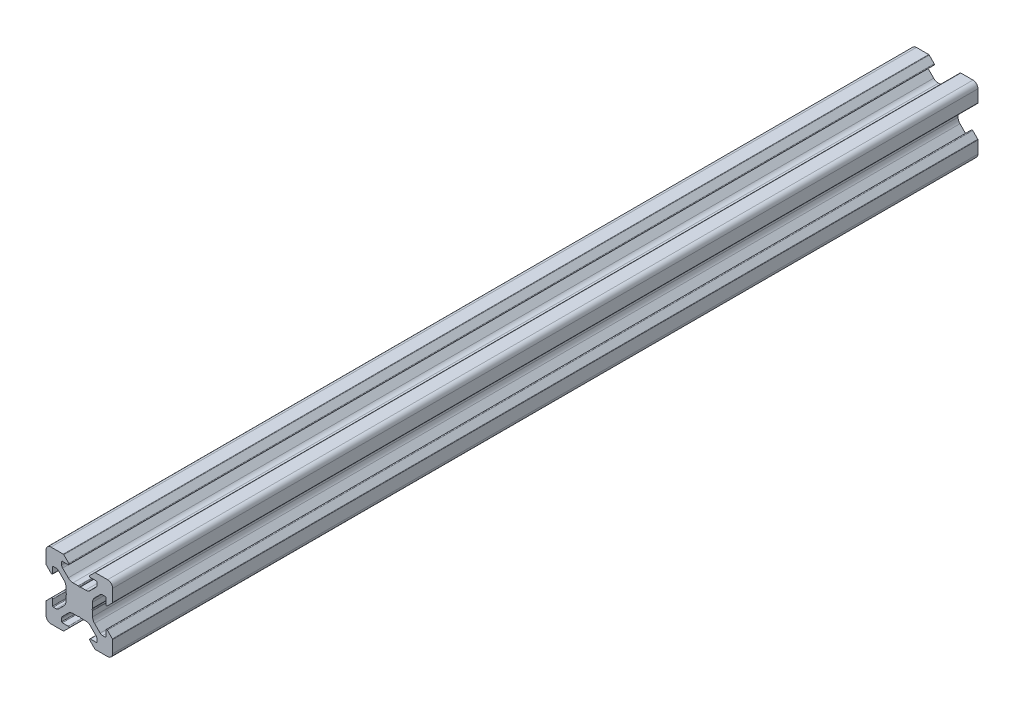
from build123d import *

# Parameters (mm, degrees)
EXTRUDE_1_DEPTH = 260


# Read off the part's stored shape, not the designer's step: 222 Конструкционный профиль 20х20-1-surface1
with BuildPart() as part:
    # Эскиз1 → Бобышка-Вытянуть1 (new body)
    with BuildSketch(Plane.XY):
        with BuildLine():
            Line((-3.945217202, 0.181521503), (-3.8, 0))
            Line((-3.8, 0), (-3.945217202, -0.181521503))
            ThreePointArc((-3.945217202, -0.181521503), (-3.98590708, -0.254943529), (-4, -0.337695265))
            Line((-4, -0.337695265), (-4, -1.898780669))
            ThreePointArc((-4, -1.898780669), (-4.152240935, -2.664147534), (-4.585786438, -3.312994231))
            Line((-4.585786438, -3.312994231), (-6.279898987, -5.007106781))
            ThreePointArc((-6.279898987, -5.007106781), (-6.604322336, -5.223879533), (-6.987005769, -5.3))
            Line((-6.987005769, -5.3), (-7.8, -5.3))
            ThreePointArc((-7.8, -5.3), (-7.941421356, -5.241421356), (-8, -5.1))
            Line((-8, -5.1), (-8, -3.33))
            ThreePointArc((-8, -3.33), (-8.154329142, -3.099030117), (-8.426776695, -3.153223305))
            Line((-8.426776695, -3.153223305), (-9.926776695, -4.653223305))
            ThreePointArc((-9.926776695, -4.653223305), (-9.980969883, -4.734329142), (-10, -4.83))
            Line((-10, -4.83), (-10, -8.5))
            ThreePointArc((-10, -8.5), (-9.560660172, -9.560660172), (-8.5, -10))
            Line((-8.5, -10), (-4.83, -10))
            ThreePointArc((-4.83, -10), (-4.734329142, -9.980969883), (-4.653223305, -9.926776695))
            Line((-4.653223305, -9.926776695), (-3.153223305, -8.426776695))
            ThreePointArc((-3.153223305, -8.426776695), (-3.099030117, -8.154329142), (-3.33, -8))
            Line((-3.33, -8), (-5.1, -8))
            ThreePointArc((-5.1, -8), (-5.241421356, -7.941421356), (-5.3, -7.8))
            Line((-5.3, -7.8), (-5.3, -6.987005769))
            ThreePointArc((-5.3, -6.987005769), (-5.223879533, -6.604322336), (-5.007106781, -6.279898987))
            Line((-5.007106781, -6.279898987), (-3.312994231, -4.585786438))
            ThreePointArc((-3.312994231, -4.585786438), (-2.664147534, -4.152240935), (-1.898780669, -4))
            Line((-1.898780669, -4), (-0.337695265, -4))
            ThreePointArc((-0.337695265, -4), (-0.254943529, -3.98590708), (-0.181521503, -3.945217202))
            Line((-0.181521503, -3.945217202), (0, -3.8))
            Line((0, -3.8), (0.181521503, -3.945217202))
            ThreePointArc((0.181521503, -3.945217202), (0.254943529, -3.98590708), (0.337695265, -4))
            Line((0.337695265, -4), (1.898780669, -4))
            ThreePointArc((1.898780669, -4), (2.664147534, -4.152240935), (3.312994231, -4.585786438))
            Line((3.312994231, -4.585786438), (5.007106781, -6.279898987))
            ThreePointArc((5.007106781, -6.279898987), (5.223879533, -6.604322336), (5.3, -6.987005769))
            Line((5.3, -6.987005769), (5.3, -7.8))
            ThreePointArc((5.3, -7.8), (5.241421356, -7.941421356), (5.1, -8))
            Line((5.1, -8), (3.33, -8))
            ThreePointArc((3.33, -8), (3.099030117, -8.154329142), (3.153223305, -8.426776695))
            Line((3.153223305, -8.426776695), (4.653223305, -9.926776695))
            ThreePointArc((4.653223305, -9.926776695), (4.734329142, -9.980969883), (4.83, -10))
            Line((4.83, -10), (8.5, -10))
            ThreePointArc((8.5, -10), (9.560660172, -9.560660172), (10, -8.5))
            Line((10, -8.5), (10, -4.83))
            ThreePointArc((10, -4.83), (9.980969883, -4.734329142), (9.926776695, -4.653223305))
            Line((9.926776695, -4.653223305), (8.426776695, -3.153223305))
            ThreePointArc((8.426776695, -3.153223305), (8.154329142, -3.099030117), (8, -3.33))
            Line((8, -3.33), (8, -5.1))
            ThreePointArc((8, -5.1), (7.941421356, -5.241421356), (7.8, -5.3))
            Line((7.8, -5.3), (6.987005769, -5.3))
            ThreePointArc((6.987005769, -5.3), (6.604322336, -5.223879533), (6.279898987, -5.007106781))
            Line((6.279898987, -5.007106781), (4.585786438, -3.312994231))
            ThreePointArc((4.585786438, -3.312994231), (4.152240935, -2.664147534), (4, -1.898780669))
            Line((4, -1.898780669), (4, -0.337695265))
            ThreePointArc((4, -0.337695265), (3.98590708, -0.254943529), (3.945217202, -0.181521503))
            Line((3.945217202, -0.181521503), (3.8, 0))
            Line((3.8, 0), (3.945217202, 0.181521503))
            ThreePointArc((3.945217202, 0.181521503), (3.98590708, 0.254943529), (4, 0.337695265))
            Line((4, 0.337695265), (4, 1.898780669))
            ThreePointArc((4, 1.898780669), (4.152240935, 2.664147534), (4.585786438, 3.312994231))
            Line((4.585786438, 3.312994231), (6.279898987, 5.007106781))
            ThreePointArc((6.279898987, 5.007106781), (6.604322336, 5.223879533), (6.987005769, 5.3))
            Line((6.987005769, 5.3), (7.8, 5.3))
            ThreePointArc((7.8, 5.3), (7.941421356, 5.241421356), (8, 5.1))
            Line((8, 5.1), (8, 3.33))
            ThreePointArc((8, 3.33), (8.154329142, 3.099030117), (8.426776695, 3.153223305))
            Line((8.426776695, 3.153223305), (9.926776695, 4.653223305))
            ThreePointArc((9.926776695, 4.653223305), (9.980969883, 4.734329142), (10, 4.83))
            Line((10, 4.83), (10, 8.5))
            ThreePointArc((10, 8.5), (9.560660172, 9.560660172), (8.5, 10))
            Line((8.5, 10), (4.83, 10))
            ThreePointArc((4.83, 10), (4.734329142, 9.980969883), (4.653223305, 9.926776695))
            Line((4.653223305, 9.926776695), (3.153223305, 8.426776695))
            ThreePointArc((3.153223305, 8.426776695), (3.099030117, 8.154329142), (3.33, 8))
            Line((3.33, 8), (5.1, 8))
            ThreePointArc((5.1, 8), (5.241421356, 7.941421356), (5.3, 7.8))
            Line((5.3, 7.8), (5.3, 6.987005769))
            ThreePointArc((5.3, 6.987005769), (5.223879533, 6.604322336), (5.007106781, 6.279898987))
            Line((5.007106781, 6.279898987), (3.312994231, 4.585786438))
            ThreePointArc((3.312994231, 4.585786438), (2.664147534, 4.152240935), (1.898780669, 4))
            Line((1.898780669, 4), (0.337695265, 4))
            ThreePointArc((0.337695265, 4), (0.254943529, 3.98590708), (0.181521503, 3.945217202))
            Line((0.181521503, 3.945217202), (0, 3.8))
            Line((0, 3.8), (-0.181521503, 3.945217202))
            ThreePointArc((-0.181521503, 3.945217202), (-0.254943529, 3.98590708), (-0.337695265, 4))
            Line((-0.337695265, 4), (-1.898780669, 4))
            ThreePointArc((-1.898780669, 4), (-2.664147534, 4.152240935), (-3.312994231, 4.585786438))
            Line((-3.312994231, 4.585786438), (-5.007106781, 6.279898987))
            ThreePointArc((-5.007106781, 6.279898987), (-5.223879533, 6.604322336), (-5.3, 6.987005769))
            Line((-5.3, 6.987005769), (-5.3, 7.8))
            ThreePointArc((-5.3, 7.8), (-5.241421356, 7.941421356), (-5.1, 8))
            Line((-5.1, 8), (-3.33, 8))
            ThreePointArc((-3.33, 8), (-3.099030117, 8.154329142), (-3.153223305, 8.426776695))
            Line((-3.153223305, 8.426776695), (-4.653223305, 9.926776695))
            ThreePointArc((-4.653223305, 9.926776695), (-4.734329142, 9.980969883), (-4.83, 10))
            Line((-4.83, 10), (-8.5, 10))
            ThreePointArc((-8.5, 10), (-9.560660172, 9.560660172), (-10, 8.5))
            Line((-10, 8.5), (-10, 4.83))
            ThreePointArc((-10, 4.83), (-9.980969883, 4.734329142), (-9.926776695, 4.653223305))
            Line((-9.926776695, 4.653223305), (-8.426776695, 3.153223305))
            ThreePointArc((-8.426776695, 3.153223305), (-8.154329142, 3.099030117), (-8, 3.33))
            Line((-8, 3.33), (-8, 5.1))
            ThreePointArc((-8, 5.1), (-7.941421356, 5.241421356), (-7.8, 5.3))
            Line((-7.8, 5.3), (-6.987005769, 5.3))
            ThreePointArc((-6.987005769, 5.3), (-6.604322336, 5.223879533), (-6.279898987, 5.007106781))
            Line((-6.279898987, 5.007106781), (-4.585786438, 3.312994231))
            ThreePointArc((-4.585786438, 3.312994231), (-4.152240935, 2.664147534), (-4, 1.898780669))
            Line((-4, 1.898780669), (-4, 0.337695265))
            ThreePointArc((-4, 0.337695265), (-3.98590708, 0.254943529), (-3.945217202, 0.181521503))
        make_face()
    extrude(amount=EXTRUDE_1_DEPTH)


solid = part.part
